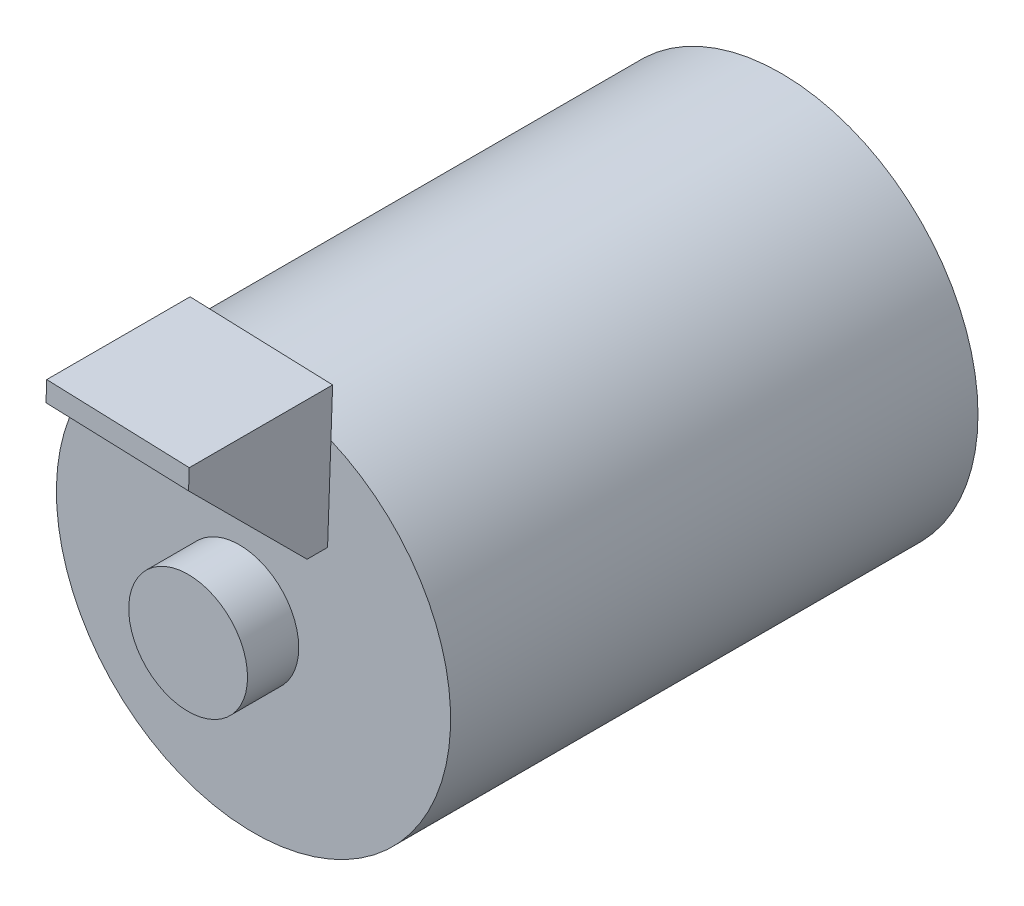
from build123d import *

# Parameters (mm, degrees)
SKETCH1_R            = 38.5
BOSS_EXTRUDE1_DEPTH  = 103
BOSS_EXTRUDE2_DEPTH  = 28
CUT_EXTRUDE1_DEPTH   = 28
SHELL2_START         = 4
SHELL2_OUTLINE_R     = 34.5
SHELL2_DEPTH         = 95
SHELL2_START_2       = 107
SHELL2_2_DEPTH       = 24
SHELL2_START_3       = 99
SHELL2_3_OUTLINE_R   = 2
SHELL2_3_DEPTH       = 12.767166294
SHELL2_START_4       = 109.767166294
SHELL2_4_OUTLINE_R   = 7.6
SHELL2_4_OUTLINE_R_2 = 2
SHELL2_4_DEPTH       = 2
SKETCH6_R            = 5
BOSS_EXTRUDE3_DEPTH  = 12


# Read off the part's stored shape, not the designer's step: Shell2
with BuildPart() as part:
    # Sketch1 → Boss-Extrude1 (new body)
    with BuildSketch(Plane.XY):
        Circle(SKETCH1_R)
    extrude(amount=BOSS_EXTRUDE1_DEPTH)

    # Sketch3 → Revolve1 (revolve)
    with BuildSketch(Plane(origin=(0, 0, 0), x_dir=(0, 0, -1), z_dir=(1, 0, 0)), mode=Mode.PRIVATE) as revolve1_sk:
        Polygon((-103, 0), (-103, -6), (-105.767166294, -6), (-105.767166294, -11.6), (-115.767166294, -11.6), (-115.767166294, 0), align=None)
    revolve(revolve1_sk.sketch.rotate(Axis((0, 0, 115.767166294), (0, 0, -1)), 270), axis=Axis((0, 0, 115.767166294), (0, 0, -1)))

    # Sketch4 → Boss-Extrude2 (add)
    with BuildSketch(Plane.XY.offset(103)):
        with BuildLine():
            Line((14.466142326, 17.000326533), (15.115842287, 35.408492088))
            ThreePointArc((15.115842287, 35.408492088), (1.281597128, 38.478663033), (-12.726276266, 36.335821064))
            Line((-12.726276266, 36.335821064), (-13.374025691, 17.982920698))
            Line((-13.374025691, 17.982920698), (0.617262695, 17.48911052))
            Line((0.617262695, 17.48911052), (14.466142326, 17.000326533))
        make_face()
        with BuildLine():
            Line((15.115842287, 35.408492088), (15.453762685, 44.982903362))
            Line((15.453762685, 44.982903362), (-12.386405332, 45.965497528))
            Line((-12.386405332, 45.965497528), (-12.726276266, 36.335821064))
            ThreePointArc((-12.726276266, 36.335821064), (1.281597128, 38.478663033), (15.115842287, 35.408492088))
        make_face()
    extrude(amount=BOSS_EXTRUDE2_DEPTH)

    # Sketch5 → Cut-Extrude1 (cut)
    with BuildSketch(Plane(origin=(-13.991288415, 0.493810179, 0), x_dir=(0, 0, 1), z_dir=(-0.9993777439159626, 0.03527215566762106, 0))):
        Polygon((107, 17.5), (131, 41.5), (131, 17.5), align=None)
    extrude(amount=-CUT_EXTRUDE1_DEPTH, mode=Mode.SUBTRACT)

    # Shell2 outline → Shell2 (cut)
    with BuildSketch(Plane.XY.offset(SHELL2_START)):
        Circle(SHELL2_OUTLINE_R)
    extrude(amount=SHELL2_DEPTH, mode=Mode.SUBTRACT)

    # Shell2 2 outline → Shell2 2 (cut)
    with BuildSketch(Plane.XY.offset(SHELL2_START_2)):
        Polygon((-9.235426092, 21.839343051), (10.609719973, 21.138926131), (11.315163087, 41.126481009), (-8.529982979, 41.826897929), align=None)
    extrude(amount=SHELL2_2_DEPTH, mode=Mode.SUBTRACT)

    # Shell2 3 outline → Shell2 3 (cut)
    with BuildSketch(Plane.XY.offset(SHELL2_START_3)):
        with BuildLine():
            Line((-9.235426092, 21.839343051), (10.609719973, 21.138926131))
            Line((10.609719973, 21.138926131), (11.017527996, 32.693486765))
            ThreePointArc((11.017527996, 32.693486765), (1.142536641, 34.481076115), (-8.82912846, 33.351109286))
            Line((-8.82912846, 33.351109286), (-9.235426092, 21.839343051))
        make_face()
        Circle(SHELL2_3_OUTLINE_R)
    extrude(amount=SHELL2_3_DEPTH, mode=Mode.SUBTRACT)

    # Shell2 4 outline → Shell2 4 (cut)
    with BuildSketch(Plane.XY.offset(SHELL2_START_4)):
        Circle(SHELL2_4_OUTLINE_R)
        Circle(SHELL2_4_OUTLINE_R_2, mode=Mode.SUBTRACT)
    extrude(amount=SHELL2_4_DEPTH, mode=Mode.SUBTRACT)

    # Sketch6 → Boss-Extrude3 (add)
    with BuildSketch(Plane(origin=(0, 0, 0), x_dir=(-1, 0, 0), z_dir=(0, 0, -1))):
        with Locations(Location((0, 0, 0), (0, 0, 180))):
            Circle(SKETCH6_R)
    extrude(amount=BOSS_EXTRUDE3_DEPTH)


solid = part.part
